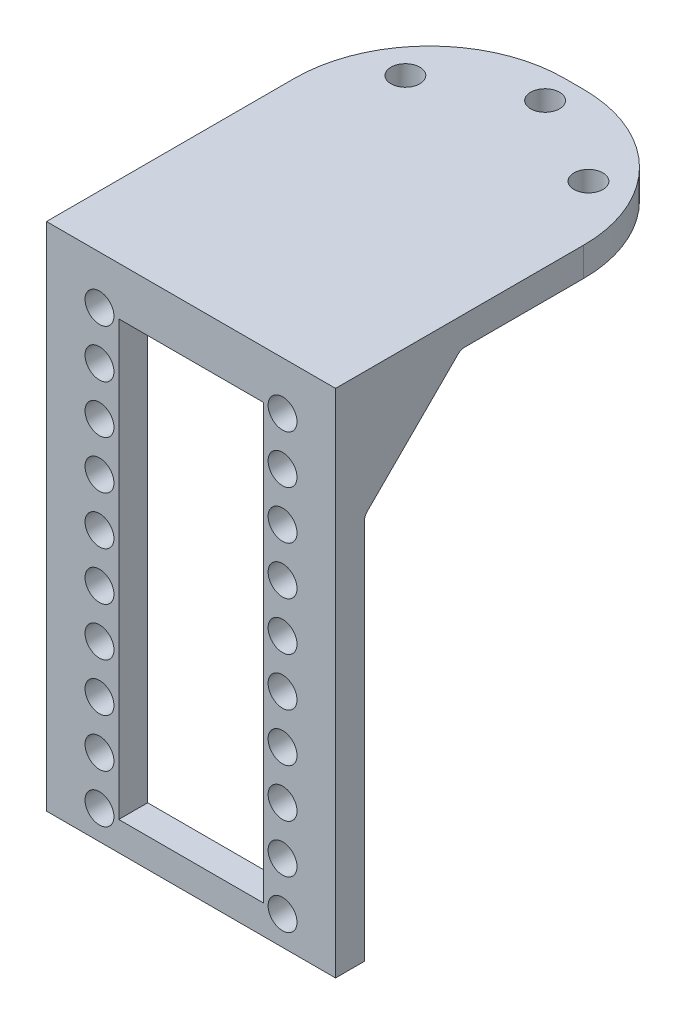
from build123d import *

# Parameters (mm, degrees)
BOSS_EXTRUDE1_DEPTH = 30
SKETCH2_R           = 1.5
CUT_EXTRUDE1_DEPTH  = 3
SKETCH3_R           = 1.5
SKETCH3_W           = 15
SKETCH3_H           = 45
CUT_EXTRUDE2_DEPTH  = 3
SKETCH4_W           = 30
SKETCH4_H           = 3
BOSS_EXTRUDE2_DEPTH = 4.75
SKETCH5_R           = 1.5
CUT_EXTRUDE3_DEPTH  = 3
BOSS_EXTRUDE3_DEPTH = 3
BOSS_EXTRUDE4_DEPTH = 3
FILLET1_R           = 1


with BuildPart() as part:
    # Sketch1 → Boss-Extrude1 (new body)
    with BuildSketch(Plane(origin=(0, 0, 0), x_dir=(0, 0, -1), z_dir=(1, 0, 0))):
        Polygon((16.175298805, 7.541832669), (16.175298805, 4.541832669), (-15.824701195, 4.541832669), (-15.824701195, -45.458167331), (-18.824701195, -45.458167331), (-18.824701195, 7.541832669), align=None)
    extrude(amount=-BOSS_EXTRUDE1_DEPTH)

    # Sketch2 → Cut-Extrude1 (cut)
    with BuildSketch(Plane(origin=(0, 7.541832669, 0), x_dir=(1, 0, 0), z_dir=(0, 1, 0))):
        with Locations(Location((-5.5, 12.925298805, 0), (0, 0, 270))):
            Circle(SKETCH2_R)
        with Locations(Location((-24.5, 12.925298805, 0), (0, 0, 270))):
            Circle(SKETCH2_R)
    extrude(amount=-CUT_EXTRUDE1_DEPTH, mode=Mode.SUBTRACT)

    # Sketch3 → Cut-Extrude2 (cut)
    with BuildSketch(Plane.XY.offset(18.824701195)):
        with Locations((-24.5, 2.541832669)):
            Circle(SKETCH3_R)
        with Locations((-5.5, 2.541832669)):
            Circle(SKETCH3_R)
        with Locations((-24.5, -2.458167331)):
            Circle(SKETCH3_R)
        with Locations((-5.5, -2.458167331)):
            Circle(SKETCH3_R)
        with Locations((-24.5, -7.458167331)):
            Circle(SKETCH3_R)
        with Locations((-5.5, -7.458167331)):
            Circle(SKETCH3_R)
        with Locations((-24.5, -12.458167331)):
            Circle(SKETCH3_R)
        with Locations((-5.5, -12.458167331)):
            Circle(SKETCH3_R)
        with Locations((-24.5, -17.458167331)):
            Circle(SKETCH3_R)
        with Locations((-5.5, -17.458167331)):
            Circle(SKETCH3_R)
        with Locations((-24.5, -22.458167331)):
            Circle(SKETCH3_R)
        with Locations((-5.5, -22.458167331)):
            Circle(SKETCH3_R)
        with Locations((-24.5, -27.458167331)):
            Circle(SKETCH3_R)
        with Locations((-5.5, -27.458167331)):
            Circle(SKETCH3_R)
        with Locations((-24.5, -32.458167331)):
            Circle(SKETCH3_R)
        with Locations((-5.5, -32.458167331)):
            Circle(SKETCH3_R)
        with Locations((-24.5, -37.458167331)):
            Circle(SKETCH3_R)
        with Locations((-5.5, -37.458167331)):
            Circle(SKETCH3_R)
        with Locations((-24.5, -42.458167331)):
            Circle(SKETCH3_R)
        with Locations((-5.5, -42.458167331)):
            Circle(SKETCH3_R)
        with Locations((-15, -19.958167331)):
            Rectangle(SKETCH3_W, SKETCH3_H)
    extrude(amount=-CUT_EXTRUDE2_DEPTH, mode=Mode.SUBTRACT)

    # Sketch4 → Boss-Extrude2 (add)
    with BuildSketch(Plane(origin=(0, 0, -16.175298805), x_dir=(-1, 0, 0), z_dir=(0, 0, -1))):
        with Locations((15, 6.041832669)):
            Rectangle(SKETCH4_W, SKETCH4_H)
    extrude(amount=BOSS_EXTRUDE2_DEPTH)

    # Sketch5 → Cut-Extrude3 (cut)
    with BuildSketch(Plane(origin=(0, 7.541832669, 0), x_dir=(1, 0, 0), z_dir=(0, 1, 0))):
        with BuildLine():
            ThreePointArc((-30, 6.925298805), (-25.899494937, 16.824793741), (-16, 20.925298805))
            Line((-16, 20.925298805), (-30, 20.925298805))
            Line((-30, 20.925298805), (-30, 6.925298805))
        make_face()
        with Locations(Location((-15, 17.925298805, 0), (0, 0, 270))):
            Circle(SKETCH5_R)
        with BuildLine():
            Line((0, 20.925298805), (-14, 20.925298805))
            ThreePointArc((-14, 20.925298805), (-4.100505063, 16.824793741), (0, 6.925298805))
            Line((0, 6.925298805), (0, 20.925298805))
        make_face()
    extrude(amount=-CUT_EXTRUDE3_DEPTH, mode=Mode.SUBTRACT)

    # Sketch6 → Boss-Extrude3 (add)
    with BuildSketch(Plane(origin=(0, 0, 0), x_dir=(0, 0, -1), z_dir=(1, 0, 0))):
        Polygon((-15.824701195, 4.541832669), (-5.824701195, 4.541832669), (-15.824701195, -5.458167331), align=None)
    extrude(amount=-BOSS_EXTRUDE3_DEPTH)

    # Sketch7 → Boss-Extrude4 (add)
    with BuildSketch(Plane.ZY.offset(30)):
        Polygon((5.824701195, 4.541832669), (15.824701195, -5.458167331), (15.824701195, 4.541832669), align=None)
    extrude(amount=-BOSS_EXTRUDE4_DEPTH)

    # Fillet1
    fillet1_edges = [part.edges().sort_by_distance(p)[0] for p in [
        (-3, -0.458167331, 15.824701195),
        (-1.5, -5.458167331, 15.824701195),
        (-3, 4.541832669, 10.824701195),
        (-1.5, 4.541832669, 5.824701195),
        (-27, 4.541832669, 10.824701195),
        (-28.5, 4.541832669, 5.824701195),
        (-27, -0.458167331, 15.824701195),
        (-28.5, -5.458167331, 15.824701195),
    ]]
    fillet(fillet1_edges, radius=FILLET1_R - 0.0001)  # a hair under: the kernel refuses the full size


solid = part.part
